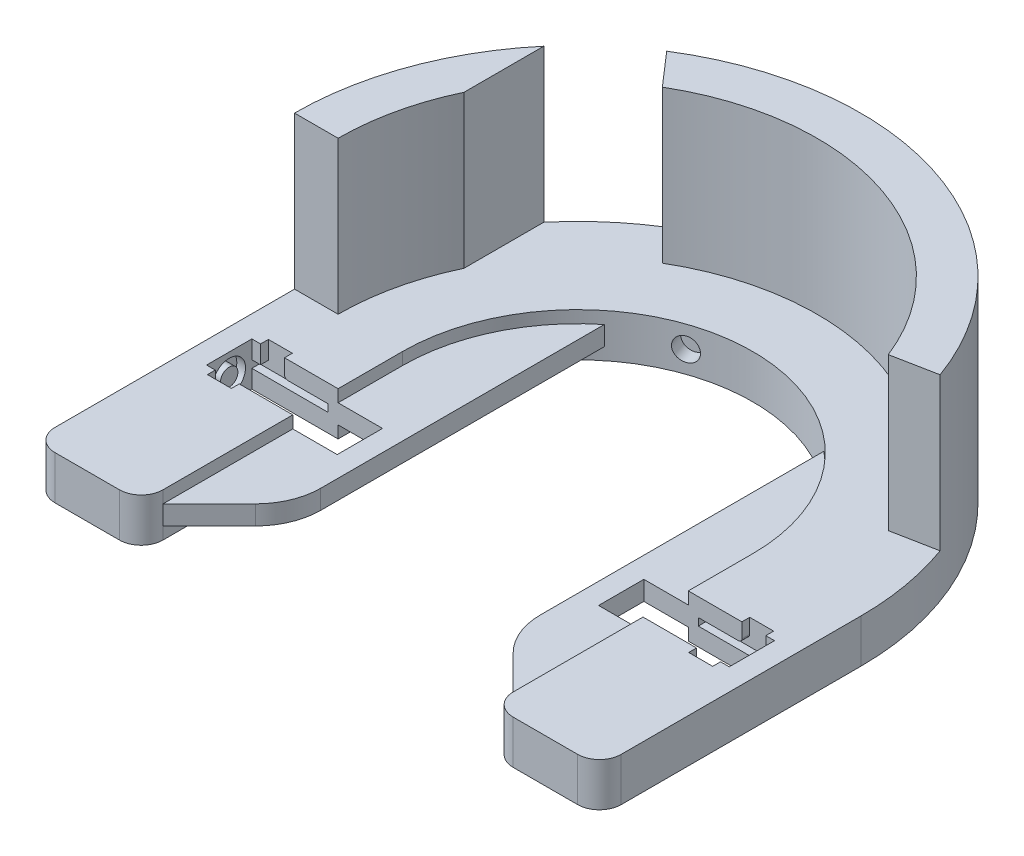
from build123d import *

# Parameters (mm, degrees)
BOSS_EXTRUDE1_DEPTH      = 2.2
BOSS_EXTRUDE1_2_DEPTH    = 2.2
BOSS_EXTRUDE2_DEPTH      = 5
BOSS_EXTRUDE3_DEPTH      = 40
BOSS_EXTRUDE3_DEPTH_BACK = 5
CUT_EXTRUDE1_DEPTH       = 101.249688279
CUT_EXTRUDE1_DEPTH_BACK  = 101.249688279
CUT_EXTRUDE2_START       = -35
SKETCH5_W                = 10.00124756
SKETCH5_H                = 45
CUT_EXTRUDE2_DEPTH       = 35
SKETCH6_R                = 2.625
CUT_EXTRUDE3_DEPTH       = 43.5
SKETCH7_W                = 30
SKETCH7_H                = 10.4
CUT_EXTRUDE4_DEPTH       = 99.361577865
SKETCH8_W                = 17.5
SKETCH8_H                = 14
CUT_EXTRUDE5_DEPTH       = 0.85
SKETCH12_R               = 3.75
SKETCH12_R_2             = 2
CUT_EXTRUDE7_DEPTH       = 2
CUT_EXTRUDE8_START       = -2
SKETCH13_R               = 3.75
SKETCH13_R_2             = 2
CUT_EXTRUDE8_DEPTH       = 2
CUT_EXTRUDE9_REACH       = 100.362
SKETCH14_W               = 5.5
SKETCH14_H               = 1.8
FILLET2_R                = 0.75


with BuildPart() as part:
    # Sketch3 → Boss-Extrude1 (new, symmetric)
    with BuildSketch(Plane(origin=(0, 0, 0), x_dir=(1, 0, 0), z_dir=(0, 1, 0))):
        with BuildLine():
            Line((40.2, -55), (40.2, 0))
            ThreePointArc((40.2, 0), (36.256585609, 17.363755354), (25.2, 31.320919527))
            Line((25.2, 31.320919527), (25.2, -33.786796564))
            ThreePointArc((25.2, -33.786796564), (26.341807012, -39.52704805), (29.593398282, -44.393398282))
            Line((29.593398282, -44.393398282), (40.2, -55))
        make_face()
    extrude(amount=BOSS_EXTRUDE1_DEPTH, both=True)



with BuildPart() as body_2:
    # Sketch3 → Boss-Extrude1 2 (new, symmetric)
    with BuildSketch(Plane(origin=(0, 0, 0), x_dir=(1, 0, 0), z_dir=(0, 1, 0))):
        with BuildLine():
            ThreePointArc((-25.2, 31.320919527), (-36.256585609, 17.363755354), (-40.2, 0))
            Line((-40.2, 0), (-40.2, -55))
            Line((-40.2, -55), (-29.593398282, -44.393398282))
            ThreePointArc((-29.593398282, -44.393398282), (-26.341807012, -39.52704805), (-25.2, -33.786796564))
            Line((-25.2, -33.786796564), (-25.2, 31.320919527))
        make_face()
    extrude(amount=BOSS_EXTRUDE1_2_DEPTH, both=True)


with BuildPart() as part_1:
    add(part.part)

    add(body_2.part)  # Boss-Extrude2 merges body 2
    # Sketch3<3> → Boss-Extrude2 (add, symmetric)
    with BuildSketch(Plane(origin=(0, 0, 0), x_dir=(1, 0, 0), z_dir=(0, 1, 0))):
        with BuildLine():
            Line((54.99875244, -60), (54.99875244, 0))
            ThreePointArc((54.99875244, 0), (0, 54.99875244), (-54.99875244, 0))
            Line((-54.99875244, 0), (-54.99875244, -60))
            Line((-54.99875244, -60), (-45.2, -60))
            ThreePointArc((-45.2, -60), (-41.664466094, -58.535533906), (-40.2, -55))
            Line((-40.2, -55), (-40.2, 0))
            ThreePointArc((-40.2, 0), (0, 40.2), (40.2, 0))
            Line((40.2, 0), (40.2, -55))
            ThreePointArc((40.2, -55), (41.664466094, -58.535533906), (45.2, -60))
            Line((45.2, -60), (54.99875244, -60))
        make_face()
    extrude(amount=BOSS_EXTRUDE2_DEPTH, both=True)

    # Sketch3<4> → Boss-Extrude3 (add, two sides: drawn at the far end of the back side and taken through both)
    with BuildSketch(Plane(origin=(0, 0, 0), x_dir=(1, 0, 0), z_dir=(0, 1, 0)).offset(-BOSS_EXTRUDE3_DEPTH_BACK)):
        with BuildLine():
            Line((65, -55), (65, 0))
            ThreePointArc((65, 0), (0, 65), (-65, 0))
            Line((-65, 0), (-65, -55))
            ThreePointArc((-65, -55), (-63.535533906, -58.535533906), (-60, -60))
            Line((-60, -60), (-54.99875244, -60))
            Line((-54.99875244, -60), (-54.99875244, 0))
            ThreePointArc((-54.99875244, 0), (0, 54.99875244), (54.99875244, 0))
            Line((54.99875244, 0), (54.99875244, -60))
            Line((54.99875244, -60), (60, -60))
            ThreePointArc((60, -60), (63.535533906, -58.535533906), (65, -55))
        make_face()
    extrude(amount=BOSS_EXTRUDE3_DEPTH + BOSS_EXTRUDE3_DEPTH_BACK)

    # Sketch4 → Cut-Extrude1 (cut, two sides: drawn at the far end of the back side and taken through both)
    with BuildSketch(Plane(origin=(0, 0, 0), x_dir=(0, 0, -1), z_dir=(1, 0, 0)).offset(-CUT_EXTRUDE1_DEPTH_BACK)):
        with BuildLine():
            Line((-45, 5), (-60, 5))
            Line((-60, 5), (-60, 40))
            Line((-60, 40), (0, 40))
            ThreePointArc((0, 40), (-28.504385627, 30.219924378), (-45, 5))
        make_face()
    extrude(amount=CUT_EXTRUDE1_DEPTH + CUT_EXTRUDE1_DEPTH_BACK, mode=Mode.SUBTRACT)

    # Sketch5 → Cut-Extrude2 (cut)
    with BuildSketch(Plane(origin=(0, 40, 0), x_dir=(1, 0, 0), z_dir=(0, 1, 0)).offset(CUT_EXTRUDE2_START)):
        with BuildLine():
            Line((-34.589058261, 55.032690726), (-27.933888882, 47.376794128))
            ThreePointArc((-27.933888882, 47.376794128), (-36.082428121, 41.508085367), (-43.028080487, 34.255613548))
            ThreePointArc((-43.028080487, 34.255613548), (-46.661464263, 29.113064469), (-49.683249866, 23.588926485))
            Line((-49.683249866, 23.588926485), (-49.683249866, 41.911510147))
            ThreePointArc((-49.683249866, 41.911510147), (-42.643836884, 49.056122714), (-34.589058261, 55.032690726))
        make_face()
        with BuildLine():
            Line((51.180271798, 20.135604003), (61.138057431, 22.071201453))
            ThreePointArc((61.138057431, 22.071201453), (64.02723535, 11.203264413), (65, 0))
            Line((65, 0), (65, -45))
            Line((65, -45), (54.99875244, -45))
            Line((54.99875244, -45), (54.99875244, 0))
            ThreePointArc((54.99875244, 0), (54.035700552, 10.247235517), (51.180271798, 20.135604003))
        make_face()
        with Locations((-59.99937622, -22.5)):
            Rectangle(SKETCH5_W, SKETCH5_H)
    extrude(amount=CUT_EXTRUDE2_DEPTH, mode=Mode.SUBTRACT)

    # Sketch6 → Cut-Extrude3 (cut)
    with BuildSketch(Plane(origin=(0, 0, 0), x_dir=(0, -1, 0), z_dir=(0.32556815445715737, 0, 0.9455185755993166))):
        Circle(SKETCH6_R)
    extrude(amount=-CUT_EXTRUDE3_DEPTH, mode=Mode.SUBTRACT)

    # Sketch7 → Cut-Extrude4 (cut, through all)
    with BuildSketch(Plane(origin=(0, 5, 0), x_dir=(1, 0, 0), z_dir=(0, 1, 0))):
        with Locations((45, -20)):
            Rectangle(SKETCH7_W, SKETCH7_H)
        with Locations((-45, -20)):
            Rectangle(SKETCH7_W, SKETCH7_H)
    extrude(amount=-CUT_EXTRUDE4_DEPTH, mode=Mode.SUBTRACT)

    # Sketch8 → Cut-Extrude5 (cut, symmetric)
    with BuildSketch(Plane(origin=(0, 0, 0), x_dir=(1, 0, 0), z_dir=(0, 1, 0))):
        with Locations((51.25, -20)):
            Rectangle(SKETCH8_W, SKETCH8_H)
        with Locations((-51.25, -20)):
            Rectangle(SKETCH8_W, SKETCH8_H)
    extrude(amount=CUT_EXTRUDE5_DEPTH, both=True, mode=Mode.SUBTRACT)

    # Sketch12 → Cut-Extrude7 (cut)
    with BuildSketch(Plane.ZY.offset(-60)):
        with Locations((20, 0)):
            Circle(SKETCH12_R)
        with Locations((20, 0)):
            Circle(SKETCH12_R_2, mode=Mode.SUBTRACT)
    extrude(amount=-CUT_EXTRUDE7_DEPTH, mode=Mode.SUBTRACT)

    # Sketch13 → Cut-Extrude8 (cut)
    with BuildSketch(Plane(origin=(-60, 0, 0), x_dir=(0, 0, -1), z_dir=(1, 0, 0)).offset(CUT_EXTRUDE8_START)):
        with Locations((-20, 0)):
            Circle(SKETCH13_R)
        with Locations((-20, 0)):
            Circle(SKETCH13_R_2, mode=Mode.SUBTRACT)
    extrude(amount=CUT_EXTRUDE8_DEPTH, mode=Mode.SUBTRACT)

    # Sketch14 → Cut-Extrude9 (cut, up to next)
    with BuildSketch(Plane(origin=(0, 5, 0), x_dir=(1, 0, 0), z_dir=(0, 1, 0)), mode=Mode.PRIVATE) as cut_extrude9_sk1:
        with Locations((-55.25, -13.9)):
            Rectangle(SKETCH14_W, SKETCH14_H)
    cut_extrude9_tool1 = extrude(cut_extrude9_sk1.sketch, amount=-CUT_EXTRUDE9_REACH, mode=Mode.PRIVATE) & part_1.part
    # Sketch14 → Cut-Extrude9 (cut, up to next)
    with BuildSketch(Plane(origin=(0, 5, 0), x_dir=(1, 0, 0), z_dir=(0, 1, 0)), mode=Mode.PRIVATE) as cut_extrude9_sk2:
        with Locations((-55.25, -26.1)):
            Rectangle(SKETCH14_W, SKETCH14_H)
    cut_extrude9_tool2 = extrude(cut_extrude9_sk2.sketch, amount=-CUT_EXTRUDE9_REACH, mode=Mode.PRIVATE) & part_1.part
    # Sketch14 → Cut-Extrude9 (cut, up to next)
    with BuildSketch(Plane(origin=(0, 5, 0), x_dir=(1, 0, 0), z_dir=(0, 1, 0)), mode=Mode.PRIVATE) as cut_extrude9_sk3:
        with Locations((55.25, -26.1)):
            Rectangle(SKETCH14_W, SKETCH14_H)
    cut_extrude9_tool3 = extrude(cut_extrude9_sk3.sketch, amount=-CUT_EXTRUDE9_REACH, mode=Mode.PRIVATE) & part_1.part
    # Sketch14 → Cut-Extrude9 (cut, up to next)
    with BuildSketch(Plane(origin=(0, 5, 0), x_dir=(1, 0, 0), z_dir=(0, 1, 0)), mode=Mode.PRIVATE) as cut_extrude9_sk4:
        with Locations((55.25, -13.9)):
            Rectangle(SKETCH14_W, SKETCH14_H)
    cut_extrude9_tool4 = extrude(cut_extrude9_sk4.sketch, amount=-CUT_EXTRUDE9_REACH, mode=Mode.PRIVATE) & part_1.part
    add(cut_extrude9_tool1.solids().sort_by_distance((-55.25, 5, 13.9))[0], mode=Mode.SUBTRACT)
    add(cut_extrude9_tool2.solids().sort_by_distance((-55.25, 5, 26.1))[0], mode=Mode.SUBTRACT)
    add(cut_extrude9_tool3.solids().sort_by_distance((55.25, 5, 26.1))[0], mode=Mode.SUBTRACT)
    add(cut_extrude9_tool4.solids().sort_by_distance((55.25, 5, 13.9))[0], mode=Mode.SUBTRACT)

    # Fillet2
    fillet2_edges = [part_1.edges().sort_by_distance(p)[0] for p in [
        (52.5, 0.85, 26.1),
        (52.5, 0.85, 13.9),
        (-52.5, 0.85, 26.1),
        (-52.5, 0.85, 13.9),
    ]]
    fillet(fillet2_edges, radius=FILLET2_R)


solid = part_1.part
